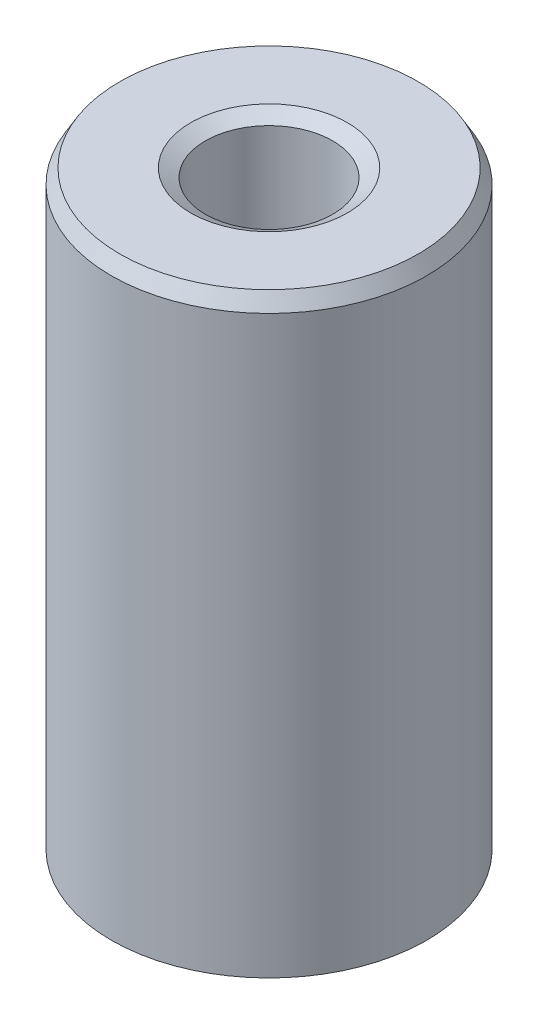
from build123d import *
from OCP.BRepFilletAPI import BRepFilletAPI_MakeChamfer

# Parameters (mm, degrees)
SKETCH1_R           = 35
BOSS_EXTRUDE1_DEPTH = 132.829947664
SKETCH2_R           = 14.130851252
CUT_EXTRUDE1_DEPTH  = 142.752583738
CHAMFER1_SIZE       = 3.246360435
CHAMFER1_SIZE2      = 1.874287071


with BuildPart() as part:
    # Sketch1 → Boss-Extrude1 (new body)
    with BuildSketch(Plane(origin=(0, 0, 0), x_dir=(1, 0, 0), z_dir=(0, 1, 0))):
        Circle(SKETCH1_R)
    extrude(amount=BOSS_EXTRUDE1_DEPTH)

    # Sketch2 → Cut-Extrude1 (cut, through all)
    with BuildSketch(Plane(origin=(0, 0, 0), x_dir=(1, 0, 0), z_dir=(0, 1, 0))):
        Circle(SKETCH2_R)
    extrude(amount=CUT_EXTRUDE1_DEPTH, mode=Mode.SUBTRACT)

    # Chamfer1: one chamfer whose edges measure the first distance from different faces: ONE call of the kernel's chamfer builder (chamfer() names one face for all edges)
    chamfer1_edges_1 = [part.edges().sort_by_distance(p)[0] for p in [
        (-14.130851252, 132.829947664, 0),
    ]]
    chamfer1_side_1 = [part.faces().sort_by_distance(p)[0] for p in [
        (-34.010050506, 132.829947664, 0),
    ]]
    chamfer1_edges_2 = [part.edges().sort_by_distance(p)[0] for p in [
        (-14.130851252, 0, 0),
    ]]
    chamfer1_side_2 = [part.faces().sort_by_distance(p)[0] for p in [
        (-14.130851252, 66.414973832, 0),
    ]]
    chamfer1_edges_3 = [part.edges().sort_by_distance(p)[0] for p in [
        (-35, 0, 0),
    ]]
    chamfer1_side_3 = [part.faces().sort_by_distance(p)[0] for p in [
        (-34.010050506, 0, 0),
    ]]
    chamfer1_edges_4 = [part.edges().sort_by_distance(p)[0] for p in [
        (-35, 132.829947664, 0),
    ]]
    chamfer1_side_4 = [part.faces().sort_by_distance(p)[0] for p in [
        (-35, 66.414973832, 0),
    ]]
    chamfer1 = BRepFilletAPI_MakeChamfer(part.part.solid().wrapped)
    for e in chamfer1_edges_1:
        chamfer1.Add(CHAMFER1_SIZE, CHAMFER1_SIZE2, e.wrapped, chamfer1_side_1[0].wrapped)  # the first distance lies on this face
    for e in chamfer1_edges_2:
        chamfer1.Add(CHAMFER1_SIZE, CHAMFER1_SIZE2, e.wrapped, chamfer1_side_2[0].wrapped)  # the first distance lies on this face
    for e in chamfer1_edges_3:
        chamfer1.Add(CHAMFER1_SIZE, CHAMFER1_SIZE2, e.wrapped, chamfer1_side_3[0].wrapped)  # the first distance lies on this face
    for e in chamfer1_edges_4:
        chamfer1.Add(CHAMFER1_SIZE, CHAMFER1_SIZE2, e.wrapped, chamfer1_side_4[0].wrapped)  # the first distance lies on this face
    add(Compound.cast(chamfer1.Shape()), mode=Mode.REPLACE)


solid = part.part
